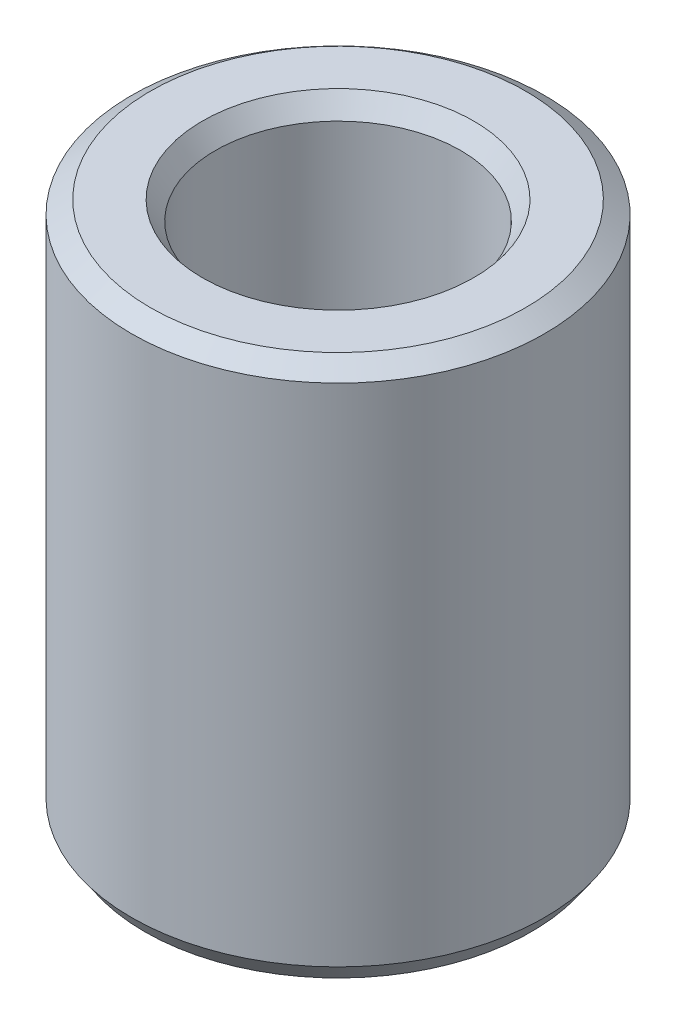
from build123d import *
from OCP.BRepFilletAPI import BRepFilletAPI_MakeChamfer

# Parameters (mm, degrees)
SKETCH1_R           = 55
BOSS_EXTRUDE1_DEPTH = 143.177631377
SKETCH2_R           = 32.655582049
CUT_EXTRUDE1_DEPTH  = 163.941198371
CHAMFER1_SIZE       = 3.496514186
CHAMFER1_SIZE2      = 5.031570901


with BuildPart() as part:
    # Sketch1 → Boss-Extrude1 (new body)
    with BuildSketch(Plane(origin=(0, 0, 0), x_dir=(1, 0, 0), z_dir=(0, 1, 0))):
        Circle(SKETCH1_R)
    extrude(amount=BOSS_EXTRUDE1_DEPTH)

    # Sketch2 → Cut-Extrude1 (cut, through all)
    with BuildSketch(Plane(origin=(0, 0, 0), x_dir=(1, 0, 0), z_dir=(0, 1, 0))):
        Circle(SKETCH2_R)
    extrude(amount=CUT_EXTRUDE1_DEPTH, mode=Mode.SUBTRACT)

    # Chamfer1: one chamfer whose edges measure the first distance from different faces: ONE call of the kernel's chamfer builder (chamfer() names one face for all edges)
    chamfer1_edges_1 = [part.edges().sort_by_distance(p)[0] for p in [
        (-32.655582049, 143.177631377, 0),
    ]]
    chamfer1_side_1 = [part.faces().sort_by_distance(p)[0] for p in [
        (-53.444365081, 143.177631377, 0),
    ]]
    chamfer1_edges_2 = [part.edges().sort_by_distance(p)[0] for p in [
        (-32.655582049, 0, 0),
    ]]
    chamfer1_side_2 = [part.faces().sort_by_distance(p)[0] for p in [
        (-32.655582049, 71.588815688, 0),
    ]]
    chamfer1_edges_3 = [part.edges().sort_by_distance(p)[0] for p in [
        (-55, 0, 0),
    ]]
    chamfer1_side_3 = [part.faces().sort_by_distance(p)[0] for p in [
        (-53.444365081, 0, 0),
    ]]
    chamfer1_edges_4 = [part.edges().sort_by_distance(p)[0] for p in [
        (-55, 143.177631377, 0),
    ]]
    chamfer1_side_4 = [part.faces().sort_by_distance(p)[0] for p in [
        (-55, 71.588815688, 0),
    ]]
    chamfer1 = BRepFilletAPI_MakeChamfer(part.part.solid().wrapped)
    for e in chamfer1_edges_1:
        chamfer1.Add(CHAMFER1_SIZE, CHAMFER1_SIZE2, e.wrapped, chamfer1_side_1[0].wrapped)  # the first distance lies on this face
    for e in chamfer1_edges_2:
        chamfer1.Add(CHAMFER1_SIZE, CHAMFER1_SIZE2, e.wrapped, chamfer1_side_2[0].wrapped)  # the first distance lies on this face
    for e in chamfer1_edges_3:
        chamfer1.Add(CHAMFER1_SIZE, CHAMFER1_SIZE2, e.wrapped, chamfer1_side_3[0].wrapped)  # the first distance lies on this face
    for e in chamfer1_edges_4:
        chamfer1.Add(CHAMFER1_SIZE, CHAMFER1_SIZE2, e.wrapped, chamfer1_side_4[0].wrapped)  # the first distance lies on this face
    add(Compound.cast(chamfer1.Shape()), mode=Mode.REPLACE)


solid = part.part
